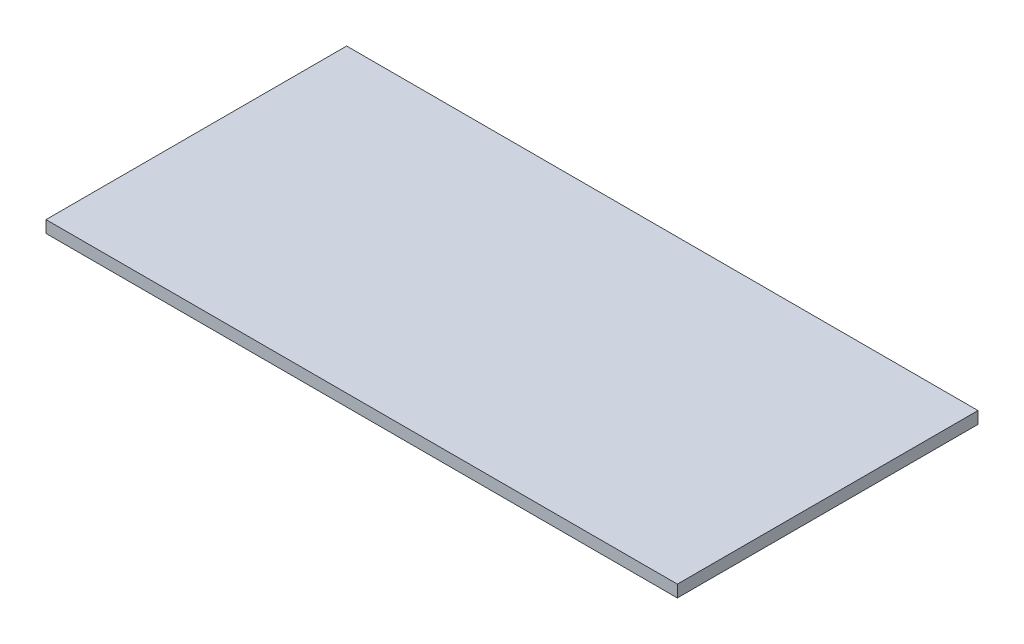
from build123d import *

# Parameters (mm, degrees)
SKETCH1_W           = 420
SKETCH1_H           = 200
BOSS_EXTRUDE1_DEPTH = 8


with BuildPart() as part:
    # Sketch1 → Boss-Extrude1 (new body)
    with BuildSketch(Plane(origin=(0, 0, 0), x_dir=(1, 0, 0), z_dir=(0, 1, 0))):
        with Locations((210, -100)):
            Rectangle(SKETCH1_W, SKETCH1_H)
    extrude(amount=BOSS_EXTRUDE1_DEPTH)


solid = part.part
